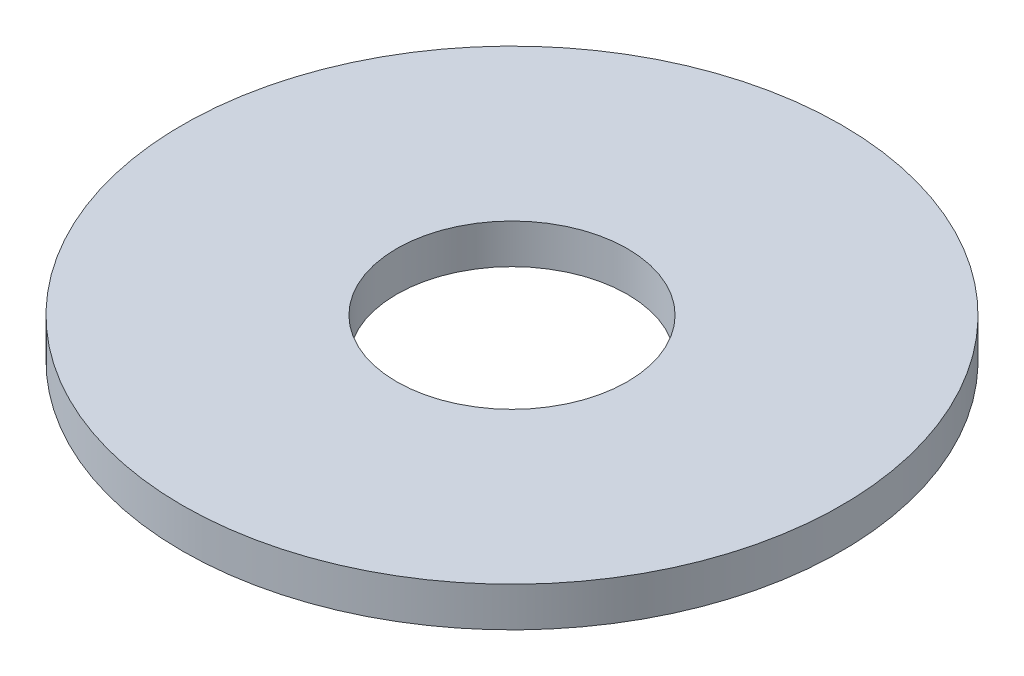
from build123d import *

# Parameters (mm, degrees)
SKETCH1_R           = 100
BOSS_EXTRUDE1_DEPTH = 12
SKETCH2_R           = 35
CUT_EXTRUDE1_DEPTH  = 142.929559994


with BuildPart() as part:
    # Sketch1 → Boss-Extrude1 (new body)
    with BuildSketch(Plane(origin=(0, 0, 0), x_dir=(1, 0, 0), z_dir=(0, 1, 0))):
        Circle(SKETCH1_R)
    extrude(amount=BOSS_EXTRUDE1_DEPTH)

    # Sketch2 → Cut-Extrude1 (cut, through all)
    with BuildSketch(Plane(origin=(0, 0, 0), x_dir=(1, 0, 0), z_dir=(0, 1, 0))):
        Circle(SKETCH2_R)
    extrude(amount=CUT_EXTRUDE1_DEPTH, mode=Mode.SUBTRACT)


solid = part.part
